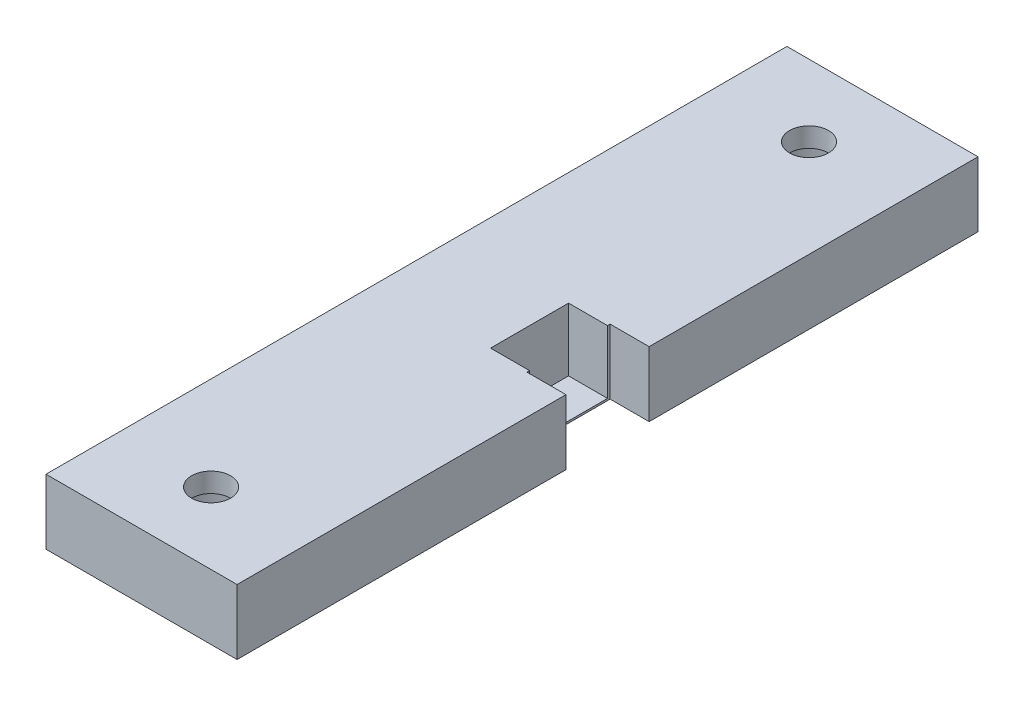
from build123d import *

# Parameters (mm, degrees)
SKETCH_2_W           = 21
SKETCH_2_H           = 57
EXTRUDE_1_DEPTH      = 5
SKETCH_3_R           = 1.5
CUT_EXTRUDE_1_DEPTH  = 5
SKETCH_4_R           = 1.5
CUT_EXTRUDE_2_DEPTH  = 5
SKETCH_5_R           = 3.5
CUT_EXTRUDE_3_DEPTH  = 3.5
SKETCH_6_R           = 3.5
CUT_EXTRUDE_4_DEPTH  = 3.5
SKETCH_8_W           = 3
SKETCH_8_H           = 57
CUT_EXTRUDE_5_DEPTH  = 5
CUT_EXTRUDE_7_DEPTH  = 5
SKETCH_11_W          = 0.3
SKETCH_11_H          = 28.5
CUT_EXTRUDE_8_DEPTH  = 5
SKETCH_12_W          = 0.3
SKETCH_12_H          = 28.5
CUT_EXTRUDE_9_DEPTH  = 10
SKETCH_13_W          = 3
SKETCH_13_H          = 0.2
CUT_EXTRUDE_10_DEPTH = 10
CUT_EXTRUDE_6_DEPTH  = 4.85


with BuildPart() as part:
    # 草图2 → 凸台-拉伸1 (new body)
    with BuildSketch(Plane(origin=(0, 0, 0), x_dir=(1, 0, 0), z_dir=(0, 1, 0))):
        with Locations((-11.930654931, -13.970581751)):
            Rectangle(SKETCH_2_W, SKETCH_2_H)
    extrude(amount=EXTRUDE_1_DEPTH)

    # 草图3 → 切除-拉伸1 (cut)
    with BuildSketch(Plane(origin=(0, 5, 0), x_dir=(1, 0, 0), z_dir=(0, 1, 0))):
        with Locations((-11.930654931, -36.970581751)):
            Circle(SKETCH_3_R)
    extrude(amount=-CUT_EXTRUDE_1_DEPTH, mode=Mode.SUBTRACT)

    # 草图4 → 切除-拉伸2 (cut)
    with BuildSketch(Plane(origin=(0, 5, 0), x_dir=(1, 0, 0), z_dir=(0, 1, 0))):
        with Locations((-11.930654931, 9.029418249)):
            Circle(SKETCH_4_R)
    extrude(amount=-CUT_EXTRUDE_2_DEPTH, mode=Mode.SUBTRACT)

    # 草图5 → 切除-拉伸3 (cut)
    with BuildSketch(Plane.XZ):
        with Locations((-11.930654931, -9.029418249)):
            Circle(SKETCH_5_R)
    extrude(amount=-CUT_EXTRUDE_3_DEPTH, mode=Mode.SUBTRACT)

    # 草图6 → 切除-拉伸4 (cut)
    with BuildSketch(Plane.XZ):
        with Locations((-11.930654931, 36.970581751)):
            Circle(SKETCH_6_R)
    extrude(amount=-CUT_EXTRUDE_4_DEPTH, mode=Mode.SUBTRACT)

    # 草图8 → 切除-拉伸5 (cut)
    with BuildSketch(Plane(origin=(0, 5, 0), x_dir=(1, 0, 0), z_dir=(0, 1, 0))):
        with Locations((-20.930654931, -13.970581751)):
            Rectangle(SKETCH_8_W, SKETCH_8_H)
        with Locations((-2.930654931, -13.970581751)):
            Rectangle(SKETCH_8_W, SKETCH_8_H)
    extrude(amount=-CUT_EXTRUDE_5_DEPTH, mode=Mode.SUBTRACT)

    # 草图10 → 切除-拉伸7 (cut)
    with BuildSketch(Plane(origin=(0, 5, 0), x_dir=(1, 0, 0), z_dir=(0, 1, 0))):
        Polygon((-4.430654931, -13.970581751), (-4.430654931, -10.970581751), (-7.430654931, -10.970581751), (-7.430654931, -16.970581751), (-4.430654931, -16.970581751), align=None)
    extrude(amount=-CUT_EXTRUDE_7_DEPTH, mode=Mode.SUBTRACT)

    # 草图11 → 切除-拉伸8 (cut)
    with BuildSketch(Plane.XZ):
        with Locations((-19.280654931, 28.220581751)):
            Rectangle(SKETCH_11_W, SKETCH_11_H)
    extrude(amount=-CUT_EXTRUDE_8_DEPTH, mode=Mode.SUBTRACT)

    # 草图12 → 切除-拉伸9 (cut)
    with BuildSketch(Plane(origin=(0, 0, 0), x_dir=(-1, 0, 0), z_dir=(0, -1, 0))):
        with Locations((19.280654931, 0.279418249)):
            Rectangle(SKETCH_12_W, SKETCH_12_H)
    extrude(amount=-CUT_EXTRUDE_9_DEPTH, mode=Mode.SUBTRACT)

    # 草图13 → 切除-拉伸10 (cut)
    with BuildSketch(Plane.XZ):
        with Locations((-5.930654931, 10.870581751)):
            Rectangle(SKETCH_13_W, SKETCH_13_H)
        with Locations((-5.930654931, 17.070581751)):
            Rectangle(SKETCH_13_W, SKETCH_13_H)
    extrude(amount=-CUT_EXTRUDE_10_DEPTH, mode=Mode.SUBTRACT)

    # 草图9 → 切除-拉伸6 (cut)
    with BuildSketch(Plane(origin=(0, 5, 0), x_dir=(1, 0, 0), z_dir=(0, 1, 0))):
        Polygon((-4.430654931, -13.970581751), (-4.430654931, -10.970581751), (-10.430654931, -10.970581751), (-10.430654931, -16.970581751), (-4.430654931, -16.970581751), align=None)
    extrude(amount=-CUT_EXTRUDE_6_DEPTH, mode=Mode.SUBTRACT)


solid = part.part
